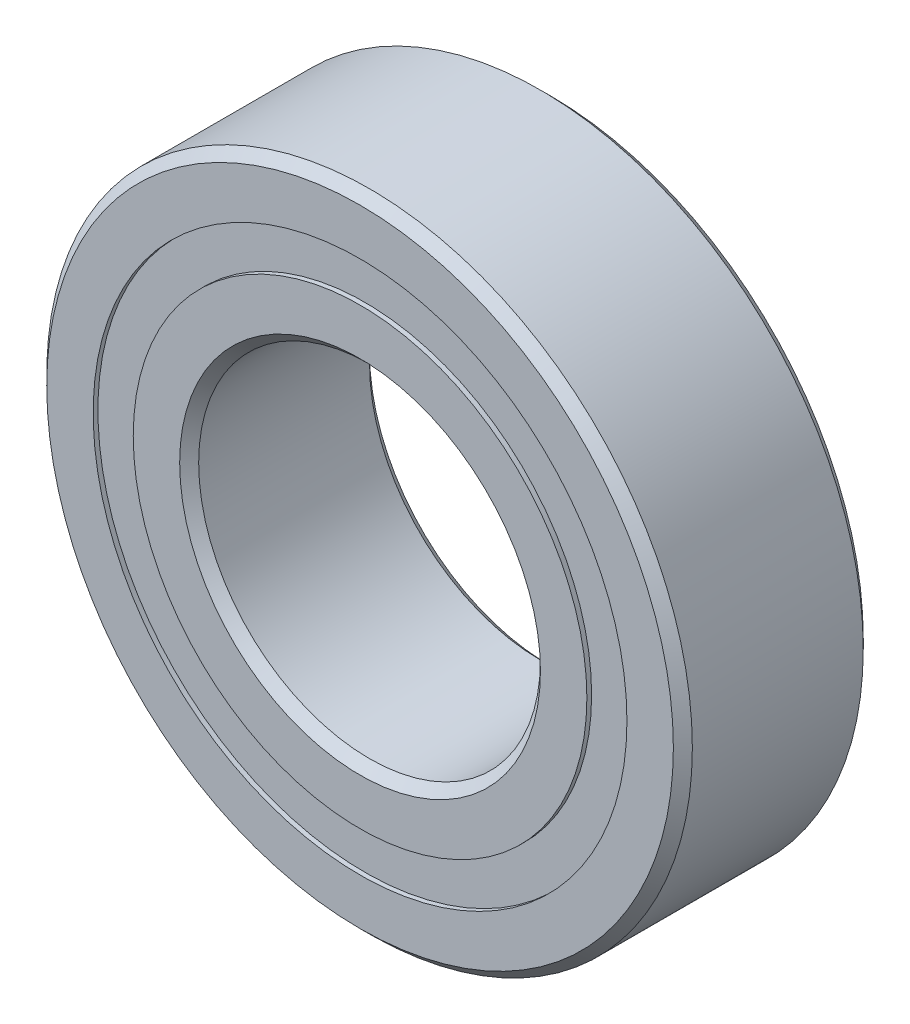
from build123d import *

# Parameters (mm, degrees)
CIRPATTERN1_COUNT = 12
SKETCH5_W         = 1.145042615
SKETCH5_H         = 1.054945054


with BuildPart() as part:
    # Sketch1 → Revolve1 (revolve)
    with BuildSketch(Plane(origin=(0, 0, 0), x_dir=(0, 0, -1), z_dir=(1, 0, 0))):
        with BuildLine():
            Line((2.25, 8.5), (-2.25, 8.5))
            Line((-2.25, 8.5), (-2.5, 8.25))
            Line((-2.5, 8.25), (-2.5, 7.027472527))
            Line((-2.5, 7.027472527), (-1.111111111, 7.027472527))
            ThreePointArc((-1.111111111, 7.027472527), (0, 7.729957385), (1.111111111, 7.027472527))
            Line((1.111111111, 7.027472527), (2.5, 7.027472527))
            Line((2.5, 7.027472527), (2.5, 8.25))
            Line((2.5, 8.25), (2.25, 8.5))
        make_face()
    revolve(axis=Axis((0, 0, 2.5), (0, 0, -1)))


with BuildPart() as body_2:
    # Sketch3 → Revolve3 (revolve)
    with BuildSketch(Plane(origin=(0, 0, 0), x_dir=(0, 0, -1), z_dir=(1, 0, 0))):
        with BuildLine():
            Line((-2.5, 5.972527473), (-1.111111111, 5.972527473))
            ThreePointArc((-1.111111111, 5.972527473), (0, 5.270042615), (1.111111111, 5.972527473))
            Line((1.111111111, 5.972527473), (2.5, 5.972527473))
            Line((2.5, 5.972527473), (2.5, 4.75))
            Line((2.5, 4.75), (2.25, 4.5))
            Line((2.25, 4.5), (-2.25, 4.5))
            Line((-2.25, 4.5), (-2.5, 4.75))
            Line((-2.5, 4.75), (-2.5, 5.972527473))
        make_face()
    revolve(axis=Axis((0, 0, 2.5), (0, 0, -1)))


with BuildPart() as body_3:
    # Sketch4 → Revolve4 (revolve)
    with BuildSketch(Plane(origin=(0, 0, 0), x_dir=(0, 0, -1), z_dir=(1, 0, 0))):
        with BuildLine():
            Line((-1.229957385, 6.5), (1.229957385, 6.5))
            ThreePointArc((1.229957385, 6.5), (0, 7.729957385), (-1.229957385, 6.5))
        make_face()
    revolve(axis=Axis((0, 6.5, 1.229957385), (0, 0, -1)))


with BuildPart() as cirpattern1_1:
    # CirPattern1: pattern copy
    add(body_3.part.rotate(Axis((0, 0, -2.5), (0, 0, 1)), 1 * 360 / CIRPATTERN1_COUNT))


with BuildPart() as cirpattern1_2:
    # CirPattern1: pattern copy
    add(body_3.part.rotate(Axis((0, 0, -2.5), (0, 0, 1)), 2 * 360 / CIRPATTERN1_COUNT))


with BuildPart() as cirpattern1_3:
    # CirPattern1: pattern copy
    add(body_3.part.rotate(Axis((0, 0, -2.5), (0, 0, 1)), 3 * 360 / CIRPATTERN1_COUNT))


with BuildPart() as cirpattern1_4:
    # CirPattern1: pattern copy
    add(body_3.part.rotate(Axis((0, 0, -2.5), (0, 0, 1)), 4 * 360 / CIRPATTERN1_COUNT))


with BuildPart() as cirpattern1_5:
    # CirPattern1: pattern copy
    add(body_3.part.rotate(Axis((0, 0, -2.5), (0, 0, 1)), 5 * 360 / CIRPATTERN1_COUNT))


with BuildPart() as cirpattern1_6:
    # CirPattern1: pattern copy
    add(body_3.part.rotate(Axis((0, 0, -2.5), (0, 0, 1)), 6 * 360 / CIRPATTERN1_COUNT))


with BuildPart() as cirpattern1_7:
    # CirPattern1: pattern copy
    add(body_3.part.rotate(Axis((0, 0, -2.5), (0, 0, 1)), 7 * 360 / CIRPATTERN1_COUNT))


with BuildPart() as cirpattern1_8:
    # CirPattern1: pattern copy
    add(body_3.part.rotate(Axis((0, 0, -2.5), (0, 0, 1)), 8 * 360 / CIRPATTERN1_COUNT))


with BuildPart() as cirpattern1_9:
    # CirPattern1: pattern copy
    add(body_3.part.rotate(Axis((0, 0, -2.5), (0, 0, 1)), 9 * 360 / CIRPATTERN1_COUNT))


with BuildPart() as cirpattern1_10:
    # CirPattern1: pattern copy
    add(body_3.part.rotate(Axis((0, 0, -2.5), (0, 0, 1)), 10 * 360 / CIRPATTERN1_COUNT))


with BuildPart() as cirpattern1_11:
    # CirPattern1: pattern copy
    add(body_3.part.rotate(Axis((0, 0, -2.5), (0, 0, 1)), 11 * 360 / CIRPATTERN1_COUNT))


with BuildPart() as body_15:
    # Sketch5 → Revolve5 (revolve)
    with BuildSketch(Plane(origin=(0, 0, 0), x_dir=(0, 0, -1), z_dir=(1, 0, 0))):
        with Locations((-1.802478693, 6.5)):
            Rectangle(SKETCH5_W, SKETCH5_H)
        with Locations((1.802478693, 6.5)):
            Rectangle(SKETCH5_W, SKETCH5_H)
    revolve(axis=Axis((0, 0, 2.5), (0, 0, -1)))


solid = Compound([part.part, body_2.part, body_3.part, cirpattern1_1.part, cirpattern1_2.part, cirpattern1_3.part, cirpattern1_4.part, cirpattern1_5.part, cirpattern1_6.part, cirpattern1_7.part, cirpattern1_8.part, cirpattern1_9.part, cirpattern1_10.part, cirpattern1_11.part, body_15.part])
